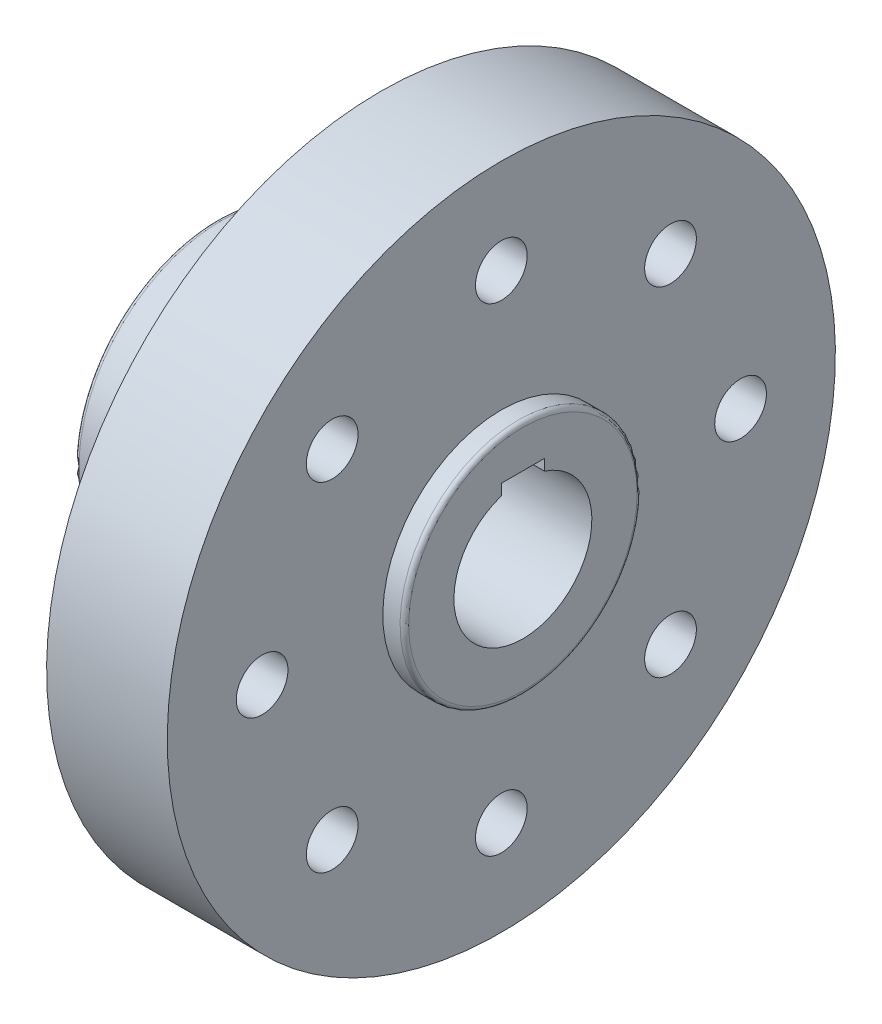
from build123d import *

# Parameters (mm, degrees)
CUT_EXTRUDE2_DEPTH = 131.589050077
SKETCH4_R          = 6
CUT_EXTRUDE3_DEPTH = 128.939438798
FILLET1_R          = 5
FILLET2_R          = 2
FILLET3_R          = 1
CHAMFER1_SIZE      = 2


with BuildPart() as part:
    # Sketch2 → Revolve1 (revolve)
    with BuildSketch(Plane.XY):
        Polygon((29.114328137, 0), (29.114328137, 27.5), (24.114328137, 27.5), (24.114328137, 77.5), (-3.885671863, 77.5), (-3.885671863, 74.5), (10.114328137, 74.5), (10.114328137, 33), (-41.885671863, 33), (-41.885671863, 0), align=None)
    revolve(axis=Axis((29.114328137, 0, 0), (-1, 0, 0)))

    # Sketch3 → Cut-Extrude2 (cut, through all)
    with BuildSketch(Plane(origin=(29.114328137, 0, 0), x_dir=(0, 0, -1), z_dir=(1, 0, 0))):
        with BuildLine():
            Line((5, 17.75), (-5, 17.75))
            Line((-5, 17.75), (-5, 15.198684154))
            ThreePointArc((-5, 15.198684154), (0, -16), (5, 15.198684154))
            Line((5, 15.198684154), (5, 17.75))
        make_face()
    extrude(amount=-CUT_EXTRUDE2_DEPTH, mode=Mode.SUBTRACT)

    # Sketch4 → Cut-Extrude3 (cut, through all)
    with BuildSketch(Plane(origin=(24.114328137, 0, 0), x_dir=(0, 0, -1), z_dir=(1, 0, 0))):
        with Locations((0, 55.5)):
            Circle(SKETCH4_R)
        with Locations((39.244426356, 39.244426356)):
            Circle(SKETCH4_R)
        with Locations((55.5, 0)):
            Circle(SKETCH4_R)
        with Locations((39.244426356, -39.244426356)):
            Circle(SKETCH4_R)
        with Locations((0, -55.5)):
            Circle(SKETCH4_R)
        with Locations((-39.244426356, -39.244426356)):
            Circle(SKETCH4_R)
        with Locations((-55.5, 0)):
            Circle(SKETCH4_R)
        with Locations((-39.244426356, 39.244426356)):
            Circle(SKETCH4_R)
    extrude(amount=-CUT_EXTRUDE3_DEPTH, mode=Mode.SUBTRACT)

    # Fillet1
    fillet1_edges = [part.edges().sort_by_distance(p)[0] for p in [
        (10.114328137, -33, 0),
    ]]
    fillet(fillet1_edges, radius=FILLET1_R)

    # Fillet2
    fillet2_edges = [part.edges().sort_by_distance(p)[0] for p in [
        (10.114328137, -74.5, 0),
    ]]
    fillet(fillet2_edges, radius=FILLET2_R)

    # Fillet3
    fillet3_edges = [part.edges().sort_by_distance(p)[0] for p in [
        (-3.885671863, -74.5, 0),
        (29.114328137, -27.5, 0),
        (-41.885671863, -33, 0),
    ]]
    fillet(fillet3_edges, radius=FILLET3_R)

    # Chamfer1
    chamfer1_edges = [part.edges().sort_by_distance(p)[0] for p in [
        (-41.885671863, -16, 0),
    ]]
    chamfer(chamfer1_edges, length=CHAMFER1_SIZE)


solid = part.part
